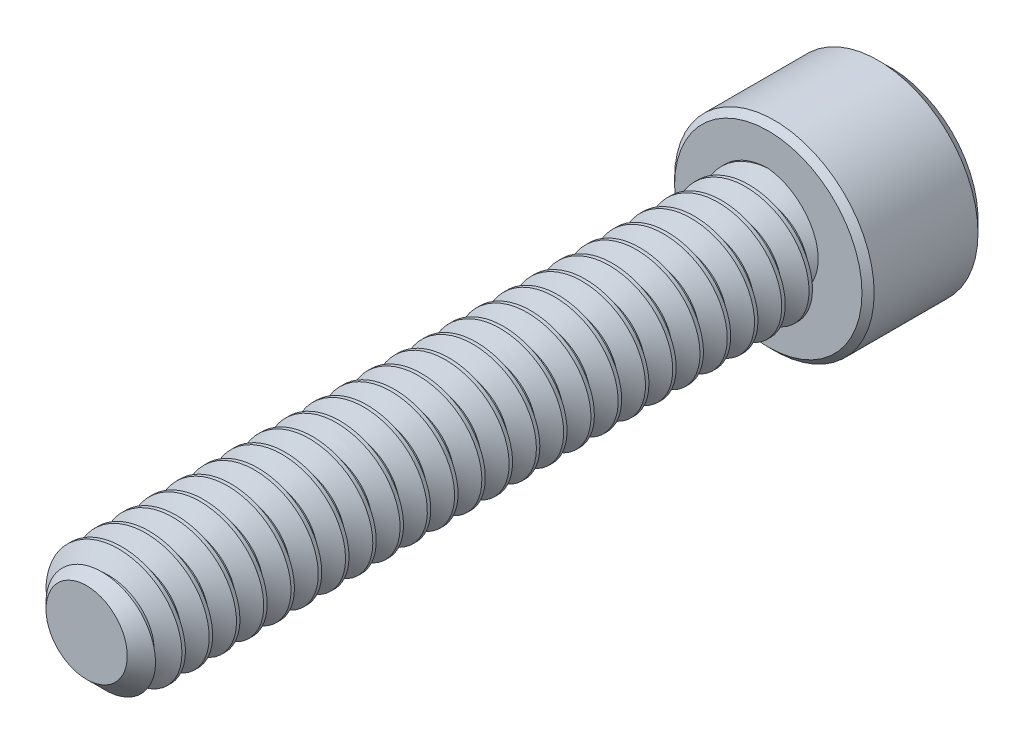
from build123d import *

# Parameters (mm, degrees)
SKETCH1_R          = 1.4224
EXTRUDE1_DEPTH     = 15.875
CHAMFER3_SIZE      = 0.47625
CUT_SWEEP1_PITCH   = 0.635
SKETCH6_R          = 2.3241
EXTRUDE2_DEPTH     = 2.8448
CUT_EXTRUDE1_DEPTH = 1.7859375
SKETCH8_R          = 1.374815329
CUT_EXTRUDE2_DEPTH = 0.28448
CUT_EXTRUDE2_DRAFT = -45
CHAMFER1_SIZE      = 0.28448
CHAMFER2_SIZE      = 0.14224


with BuildPart() as part:
    # Sketch1 → Extrude1 (new body)
    with BuildSketch(Plane.XY):
        Circle(SKETCH1_R)
    extrude(amount=-EXTRUDE1_DEPTH)

    # Chamfer3
    chamfer3_edges = [part.edges().sort_by_distance(p)[0] for p in [
        (-1.4224, 0, 0),
    ]]
    chamfer(chamfer3_edges, length=CHAMFER3_SIZE)

    # Cut-Sweep1: arcs per turn and ends read off the stored shape
    # Cut-Sweep1: the profile of Sketch3 profile screwed along a right-hand helix through 27 turns, 6 arcs to a turn; built about Z, then put on its axis
    cut_sweep1_z = Axis((0, 0, 0), (0, 0, 1))
    cut_sweep1_corners = [(1.4227, 0, -0.555798205), (1.009955401, 0, -0.3175), (1.009955401, 0, -0.238125), (1.4227, 0, 0.000173205)]
    with BuildLine(mode=Mode.PRIVATE) as cut_sweep1_profile:
        Line(cut_sweep1_corners[0], cut_sweep1_corners[1])
        Line(cut_sweep1_corners[1], cut_sweep1_corners[2])
        Line(cut_sweep1_corners[2], cut_sweep1_corners[3])
        Line(cut_sweep1_corners[3], cut_sweep1_corners[0])
    cut_sweep1_cap = Face(cut_sweep1_profile.wire())
    cut_sweep1_turn_angles = [0, 30, 60, 90, 120, 150, 180, 210, 240, 270, 300, 330, 360]
    cut_sweep1_turn_weights = [1, 0.8660254037844387, 1, 0.8660254037844387, 1, 0.8660254037844387, 1, 0.8660254037844387, 1, 0.8660254037844387, 1, 0.8660254037844387, 1]
    cut_sweep1_turn_rails = [Edge.make_bspline([Vector(p[0], p[1], 0).rotate(cut_sweep1_z, cut_sweep1_turn_angles[k]) / cut_sweep1_turn_weights[k] + Vector(0, 0, p[2] + CUT_SWEEP1_PITCH * cut_sweep1_turn_angles[k] / 360) for k in range(13)], [0, 0, 0, 1, 1, 2, 2, 3, 3, 4, 4, 5, 5, 6, 6, 6], 2, cut_sweep1_turn_weights) for p in cut_sweep1_corners]
    cut_sweep1_turn_sides = [Face.make_surface_from_curves(cut_sweep1_turn_rails[p[0]], cut_sweep1_turn_rails[p[1]]) for p in [(0, 1), (1, 2), (2, 3), (3, 0)]]
    cut_sweep1 = Plane(origin=(0, 0, 0), x_dir=(0, 1, 0), z_dir=(0, 0, -1)) * Solid(Shell([*[p.moved(Location((0, 0, CUT_SWEEP1_PITCH * i))) for i in range(27) for p in cut_sweep1_turn_sides], cut_sweep1_cap, cut_sweep1_cap.rotate(cut_sweep1_z, 9720).moved(Location((0, 0, CUT_SWEEP1_PITCH * 9720 / 360)))]))
    add(cut_sweep1, mode=Mode.SUBTRACT)

    # Sketch6 → Extrude2 (add)
    with BuildSketch(Plane(origin=(0, 0, -15.875), x_dir=(-1, 0, 0), z_dir=(0, 0, -1))):
        Circle(SKETCH6_R)
    extrude(amount=EXTRUDE2_DEPTH)

    # Sketch7 → Cut-Extrude1 (cut)
    with BuildSketch(Plane(origin=(0, 0, -18.7198), x_dir=(-1, 0, 0), z_dir=(0, 0, -1))):
        Polygon((0, 1.374815329), (-1.190625, 0.687407664), (-1.190625, -0.687407664), (0, -1.374815329), (1.190625, -0.687407664), (1.190625, 0.687407664), align=None)
    extrude(amount=-CUT_EXTRUDE1_DEPTH, mode=Mode.SUBTRACT)


with BuildPart() as cut_extrude2_tool:
    # Sketch8 → Cut-Extrude2 (with draft: the straight prism first)
    with BuildSketch(Plane(origin=(0, 0, -18.7198), x_dir=(-1, 0, 0), z_dir=(0, 0, -1))):
        Circle(SKETCH8_R)
    extrude(amount=-CUT_EXTRUDE2_DEPTH)
    # Cut-Extrude2: the draft: its side faces are tilted about the plane it starts from
    cut_extrude2_sides = [cut_extrude2_tool.faces().sort_by_distance(p)[0] for p in [
        (1.374815329, 0, -18.57756),
    ]]
    draft(cut_extrude2_sides, Plane(origin=(0, 0, -18.7198), x_dir=(-1, 0, 0), z_dir=(0, 0, -1)), CUT_EXTRUDE2_DRAFT)


with BuildPart() as part_1:
    add(part.part)

    # Cut-Extrude2: cut by cut_extrude2_tool
    add(cut_extrude2_tool.part, mode=Mode.SUBTRACT)

    # Chamfer1
    chamfer1_edges = [part_1.edges().sort_by_distance(p)[0] for p in [
        (2.3241, 0, -18.7198),
    ]]
    chamfer(chamfer1_edges, length=CHAMFER1_SIZE)

    # Chamfer2
    chamfer2_edges = [part_1.edges().sort_by_distance(p)[0] for p in [
        (2.3241, 0, -15.875),
    ]]
    chamfer(chamfer2_edges, length=CHAMFER2_SIZE)


solid = part_1.part
